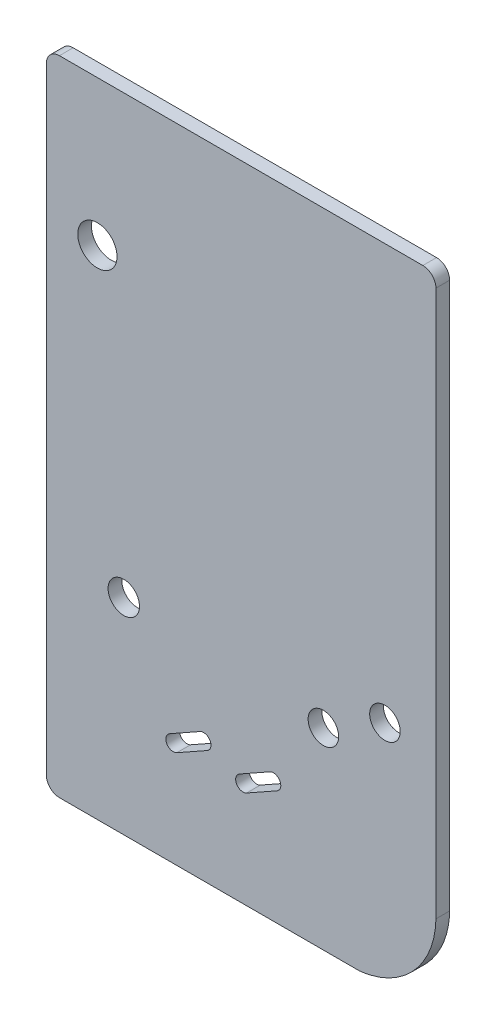
from build123d import *

# Parameters (mm, degrees)
SKETCH1_R           = 3.6
SKETCH1_R_2         = 3.5
BOSS_EXTRUDE1_DEPTH = 3.14
SKETCH1_3_W         = 50.090098238
SKETCH1_3_H         = 45.92830966
SKETCH1_3_R         = 4.5
BOSS_EXTRUDE2_DEPTH = 3.14
SKETCH1_4_W         = 50.090098238
SKETCH1_4_H         = 45.92830966
BOSS_EXTRUDE3_DEPTH = 3.14


with BuildPart() as part:
    # Sketch1 → Boss-Extrude1 (new body)
    with BuildSketch(Plane.XY):
        with BuildLine():
            add(Edge.make_bspline(
                [(-41.648963672, 73.647136153), (-44.643488897, 73.643488897), (-44.647136153, 70.648963672)],
                knots=[3.927599805, 3.927599805, 3.927599805, 5.497178156, 5.497178156, 5.497178156], degree=2, weights=[1, 0.707537269, 1]))
            Line((-44.647136153, 70.648963672), (-44.647136153, -70.648963672))
            add(Edge.make_bspline(
                [(-44.647136153, -70.648963672), (-44.643488897, -73.643488897), (-41.648963672, -73.647136153)],
                knots=[3.927599805, 3.927599805, 3.927599805, 5.497178156, 5.497178156, 5.497178156], degree=2, weights=[1, 0.707537269, 1]))
            Line((-41.648963672, -73.647136153), (27.093393639, -73.647136153))
            add(Edge.make_bspline(
                [(44.647136153, -54.550700861), (44.629350083, -55.622608831), (44.523578432, -56.687840097), (44.215717336, -58.366181711), (44.071515423, -58.983678353), (43.719242041, -60.213836545), (43.51280516, -60.820227412), (42.807525079, -62.600781834), (42.22206304, -63.742215888), (41.337337041, -65.108539745), (41.152542037, -65.37883334), (40.771685792, -65.906986664), (40.57512321, -66.165654002), (39.967232089, -66.92560473), (39.108255703, -67.89614606), (38.152323748, -68.781197278), (37.146406736, -69.622175477), (36.615243643, -70.022491506), (34.981146078, -71.128530207), (33.83112161, -71.747972893), (32.318701378, -72.376617626), (32.012437216, -72.49499434), (31.392225647, -72.716804064), (31.077608459, -72.820394039), (30.133341911, -73.105042114), (29.500121034, -73.261325902), (28.276366882, -73.499851982), (27.686391293, -73.587126278), (27.093393639, -73.647136153)],
                knots=[0.018260035, 0.018260035, 0.018260035, 0.018260035, 0.125, 0.125, 0.1875, 0.1875, 0.25, 0.25, 0.375, 0.375, 0.40625, 0.40625, 0.4375, 0.4375, 0.5, 0.5625, 0.5625, 0.625, 0.625, 0.75, 0.75, 0.78125, 0.78125, 0.8125, 0.8125, 0.875, 0.875, 0.932610516, 0.932610516, 0.932610516, 0.932610516], degree=3))
            Line((44.647136153, -54.550700861), (44.647136153, 70.648963672))
            add(Edge.make_bspline(
                [(44.647136153, 70.648963672), (44.643488897, 73.643488897), (41.648963672, 73.647136153)],
                knots=[3.927599805, 3.927599805, 3.927599805, 5.497178156, 5.497178156, 5.497178156], degree=2, weights=[1, 0.707537269, 1]))
            Line((41.648963672, 73.647136153), (-41.648963672, 73.647136153))
        make_face()
        with BuildLine():
            Line((39.139308268, 60.005147218), (39.139308268, 13.683084381))
            ThreePointArc((39.139308268, 13.683084381), (36.430045993, 7.142346655), (29.889308268, 4.433084381))
            Line((29.889308268, 4.433084381), (-36.027217939, 4.433084381))
            ThreePointArc((-36.027217939, 4.433084381), (-37.794984892, 5.165317428), (-38.527217939, 6.933084381))
            Line((-38.527217939, 6.933084381), (-38.527217939, 60.005147218))
            ThreePointArc((-38.527217939, 60.005147218), (-37.794984892, 61.772914171), (-36.027217939, 62.505147218))
            Line((-36.027217939, 62.505147218), (36.639308268, 62.505147218))
            ThreePointArc((36.639308268, 62.505147218), (38.40707522, 61.772914171), (39.139308268, 60.005147218))
        make_face(mode=Mode.SUBTRACT)
        with BuildLine():
            ThreePointArc((-14.745996033, -51.265124074), (-17.044884469, -50.621435312), (-16.401195707, -48.322546875))
            Line((-16.401195707, -48.322546875), (-9.42859141, -44.400456958))
            ThreePointArc((-9.42859141, -44.400456958), (-7.129702973, -45.04414572), (-7.773391736, -47.343034157))
            Line((-7.773391736, -47.343034157), (-14.745996033, -51.265124074))
        make_face(mode=Mode.SUBTRACT)
        with Locations((-26.900831216, -26.517202566)):
            Circle(SKETCH1_R, mode=Mode.SUBTRACT)
        with BuildLine():
            ThreePointArc((1.254003967, -51.265124074), (-1.044884469, -50.621435312), (-0.401195707, -48.322546875))
            Line((-0.401195707, -48.322546875), (6.57140859, -44.400456958))
            ThreePointArc((6.57140859, -44.400456958), (8.870297027, -45.04414572), (8.226608264, -47.343034157))
            Line((8.226608264, -47.343034157), (1.254003967, -51.265124074))
        make_face(mode=Mode.SUBTRACT)
        with Locations((18.849494268, -29.546234455)):
            Circle(SKETCH1_R_2, mode=Mode.SUBTRACT)
        with Locations((32.960239, -21.476652312)):
            Circle(SKETCH1_R_2, mode=Mode.SUBTRACT)
    extrude(amount=BOSS_EXTRUDE1_DEPTH)

    # Sketch1<3> → Boss-Extrude2 (add)
    with BuildSketch(Plane.XY):
        with BuildLine():
            Line((39.139308268, 13.683084381), (39.139308268, 60.005147218))
            ThreePointArc((39.139308268, 60.005147218), (38.40707522, 61.772914171), (36.639308268, 62.505147218))
            Line((36.639308268, 62.505147218), (-36.027217939, 62.505147218))
            ThreePointArc((-36.027217939, 62.505147218), (-37.794984892, 61.772914171), (-38.527217939, 60.005147218))
            Line((-38.527217939, 60.005147218), (-38.527217939, 6.933084381))
            ThreePointArc((-38.527217939, 6.933084381), (-37.794984892, 5.165317428), (-36.027217939, 4.433084381))
            Line((-36.027217939, 4.433084381), (29.889308268, 4.433084381))
            ThreePointArc((29.889308268, 4.433084381), (36.430045993, 7.142346655), (39.139308268, 13.683084381))
        make_face()
        with Locations((-0.122821054, 33.25213261)):
            Rectangle(SKETCH1_3_W, SKETCH1_3_H, mode=Mode.SUBTRACT)
        with Locations((-32.953932198, 40.341063425)):
            Circle(SKETCH1_3_R, mode=Mode.SUBTRACT)
    extrude(amount=BOSS_EXTRUDE2_DEPTH)

    # Sketch1<4> → Boss-Extrude3 (add)
    with BuildSketch(Plane.XY):
        with Locations((-0.122821054, 33.25213261)):
            Rectangle(SKETCH1_4_W, SKETCH1_4_H)
    extrude(amount=BOSS_EXTRUDE3_DEPTH)


solid = part.part
